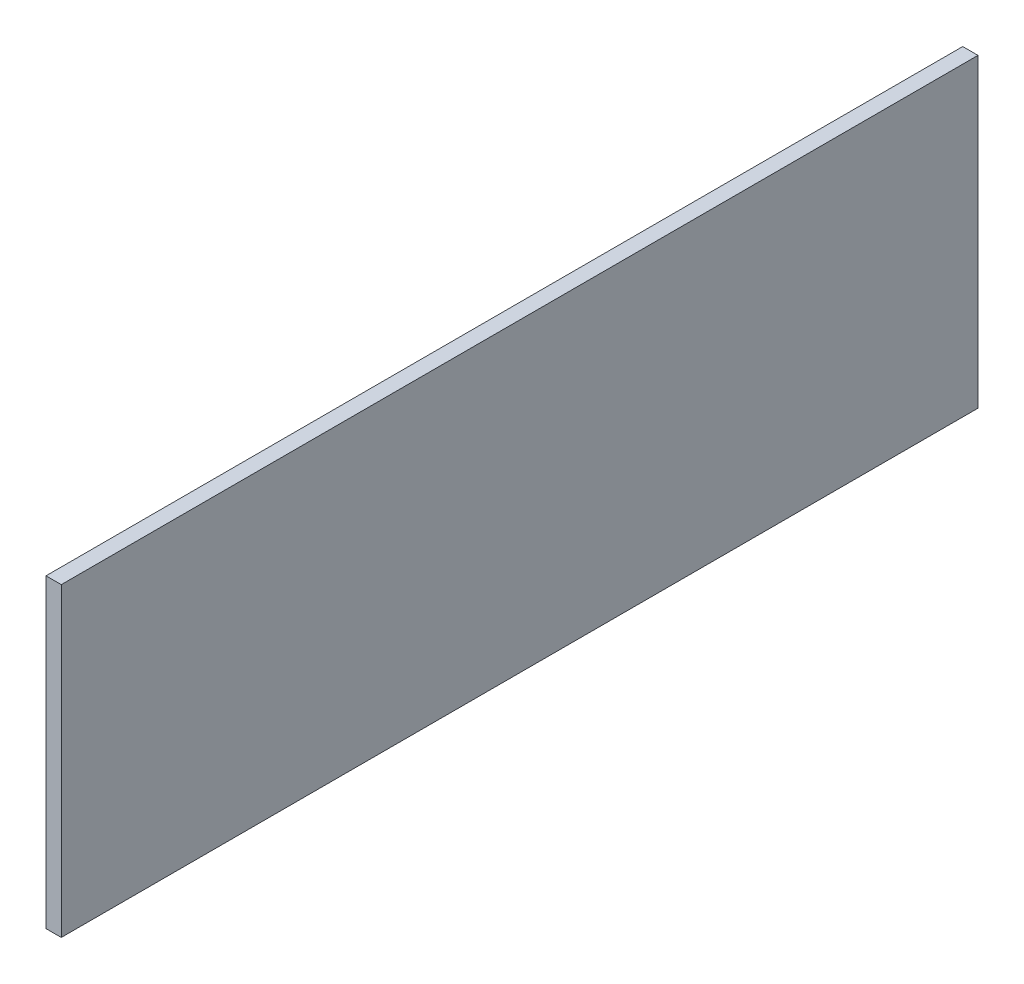
from build123d import *

# Parameters (mm, degrees)
SKETCH1_W           = 1200
SKETCH1_H           = 400
BOSS_EXTRUDE1_DEPTH = 20


with BuildPart() as part:
    # Sketch1 → Boss-Extrude1 (new body)
    with BuildSketch(Plane(origin=(0, 0, 0), x_dir=(0, 0, -1), z_dir=(1, 0, 0))):
        with Locations((48.148148148, 218.055555556)):
            Rectangle(SKETCH1_W, SKETCH1_H)
    extrude(amount=BOSS_EXTRUDE1_DEPTH)


solid = part.part
